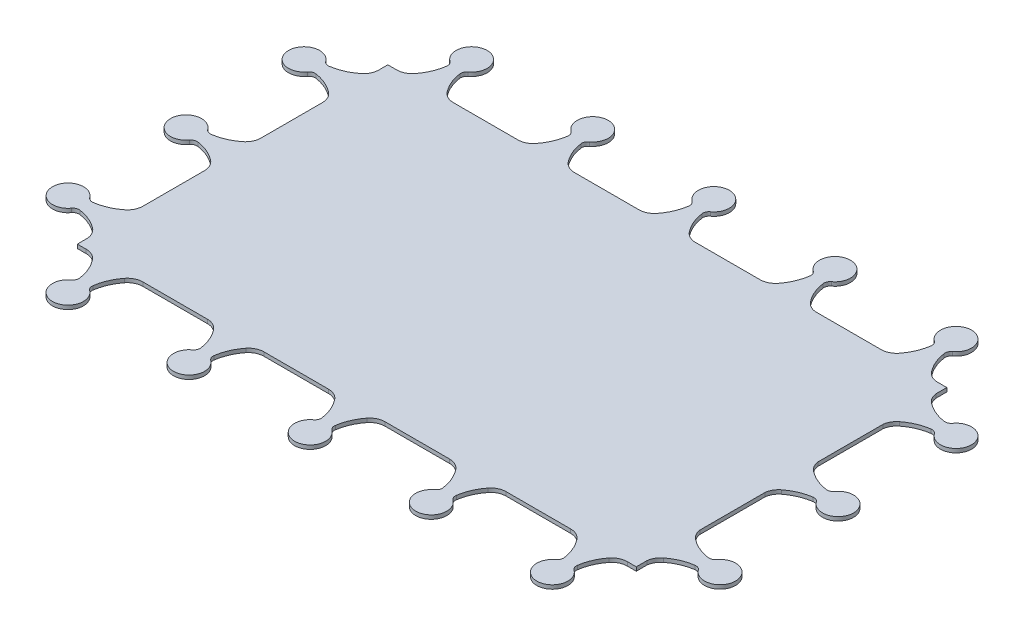
from build123d import *

# Parameters (mm, degrees)
BOSS_EXTRUDE1_DEPTH  = 3.175
BOSS_EXTRUDE2_DEPTH  = 3.175
LPATTERN1_COUNT      = 5
LPATTERN1_PITCH      = 99.06
MIRROR1_COPY_1_DEPTH = 3.175
MIRROR1_COPY_2_DEPTH = 3.175
MIRROR1_COPY_3_DEPTH = 3.175
MIRROR1_COPY_4_DEPTH = 3.175
MIRROR1_COPY_5_DEPTH = 3.175
BOSS_EXTRUDE3_DEPTH  = 3.175
LPATTERN2_COUNT      = 3
LPATTERN2_PITCH      = 96.52
MIRROR2_COPY_1_DEPTH = 3.175
MIRROR2_COPY_2_DEPTH = 3.175
MIRROR2_COPY_3_DEPTH = 3.175


with BuildPart() as part:
    # Sketch1 → Boss-Extrude1 (new body)
    with BuildSketch(Plane(origin=(0, 0, 0), x_dir=(1, 0, 0), z_dir=(0, 1, 0))):
        Polygon((0, 200.406867622), (0, 0), (457.2, 0), (457.2, 254), (53.593132378, 254), (7.268244995, 254), (0, 254), (0, 246.731755005), align=None)
    extrude(amount=BOSS_EXTRUDE1_DEPTH)

    # Sketch1<3> → Boss-Extrude2 (add)
    with BuildSketch(Plane(origin=(0, 0, 0), x_dir=(1, 0, 0), z_dir=(0, 1, 0))):
        with BuildLine():
            Line((7.268244995, 254), (53.593132378, 254))
            ThreePointArc((53.593132378, 254), (48.043028868, 255.276937756), (43.609009881, 258.850968343))
            ThreePointArc((43.609009881, 258.850968343), (38.533476821, 267.409528266), (35.84709227, 276.990411412))
            ThreePointArc((35.84709227, 276.990411412), (36.197138958, 279.690776765), (37.891385065, 281.82245119))
            ThreePointArc((37.891385065, 281.82245119), (30.430688687, 304.8), (22.969992308, 281.82245119))
            ThreePointArc((22.969992308, 281.82245119), (24.664238415, 279.690776765), (25.014285104, 276.990411412))
            ThreePointArc((25.014285104, 276.990411412), (22.327900553, 267.409528266), (17.252367493, 258.850968343))
            ThreePointArc((17.252367493, 258.850968343), (12.818348506, 255.276937756), (7.268244995, 254))
        make_face()
    boss_extrude2 = extrude(amount=BOSS_EXTRUDE2_DEPTH)

    # LPattern1: Boss-Extrude2 ×5
    with Locations(*[(i * LPATTERN1_PITCH, 0, 0) for i in range(1, LPATTERN1_COUNT)]):
        add(boss_extrude2)

    # Mirror1 copy 1 sketch → Mirror1 copy 1 (add)
    with BuildSketch(Plane(origin=(99.06, 0, -254), x_dir=(1, 0, 0), z_dir=(0, 1, 0))):
        with BuildLine():
            Line((7.268244995, -254), (53.593132378, -254))
            ThreePointArc((53.593132378, -254), (48.043028868, -255.276937756), (43.609009881, -258.850968343))
            ThreePointArc((43.609009881, -258.850968343), (38.533476821, -267.409528266), (35.84709227, -276.990411412))
            ThreePointArc((35.84709227, -276.990411412), (36.197138958, -279.690776765), (37.891385065, -281.82245119))
            ThreePointArc((37.891385065, -281.82245119), (30.430688687, -304.8), (22.969992308, -281.82245119))
            ThreePointArc((22.969992308, -281.82245119), (24.664238415, -279.690776765), (25.014285104, -276.990411412))
            ThreePointArc((25.014285104, -276.990411412), (22.327900553, -267.409528266), (17.252367493, -258.850968343))
            ThreePointArc((17.252367493, -258.850968343), (12.818348506, -255.276937756), (7.268244995, -254))
        make_face()
    extrude(amount=MIRROR1_COPY_1_DEPTH)

    # Mirror1 copy 2 sketch → Mirror1 copy 2 (add)
    with BuildSketch(Plane(origin=(198.12, 0, -254), x_dir=(1, 0, 0), z_dir=(0, 1, 0))):
        with BuildLine():
            Line((7.268244995, -254), (53.593132378, -254))
            ThreePointArc((53.593132378, -254), (48.043028868, -255.276937756), (43.609009881, -258.850968343))
            ThreePointArc((43.609009881, -258.850968343), (38.533476821, -267.409528266), (35.84709227, -276.990411412))
            ThreePointArc((35.84709227, -276.990411412), (36.197138958, -279.690776765), (37.891385065, -281.82245119))
            ThreePointArc((37.891385065, -281.82245119), (30.430688687, -304.8), (22.969992308, -281.82245119))
            ThreePointArc((22.969992308, -281.82245119), (24.664238415, -279.690776765), (25.014285104, -276.990411412))
            ThreePointArc((25.014285104, -276.990411412), (22.327900553, -267.409528266), (17.252367493, -258.850968343))
            ThreePointArc((17.252367493, -258.850968343), (12.818348506, -255.276937756), (7.268244995, -254))
        make_face()
    extrude(amount=MIRROR1_COPY_2_DEPTH)

    # Mirror1 copy 3 sketch → Mirror1 copy 3 (add)
    with BuildSketch(Plane(origin=(297.18, 0, -254), x_dir=(1, 0, 0), z_dir=(0, 1, 0))):
        with BuildLine():
            Line((7.268244995, -254), (53.593132378, -254))
            ThreePointArc((53.593132378, -254), (48.043028868, -255.276937756), (43.609009881, -258.850968343))
            ThreePointArc((43.609009881, -258.850968343), (38.533476821, -267.409528266), (35.84709227, -276.990411412))
            ThreePointArc((35.84709227, -276.990411412), (36.197138958, -279.690776765), (37.891385065, -281.82245119))
            ThreePointArc((37.891385065, -281.82245119), (30.430688687, -304.8), (22.969992308, -281.82245119))
            ThreePointArc((22.969992308, -281.82245119), (24.664238415, -279.690776765), (25.014285104, -276.990411412))
            ThreePointArc((25.014285104, -276.990411412), (22.327900553, -267.409528266), (17.252367493, -258.850968343))
            ThreePointArc((17.252367493, -258.850968343), (12.818348506, -255.276937756), (7.268244995, -254))
        make_face()
    extrude(amount=MIRROR1_COPY_3_DEPTH)

    # Mirror1 copy 4 sketch → Mirror1 copy 4 (add)
    with BuildSketch(Plane(origin=(396.24, 0, -254), x_dir=(1, 0, 0), z_dir=(0, 1, 0))):
        with BuildLine():
            Line((7.268244995, -254), (53.593132378, -254))
            ThreePointArc((53.593132378, -254), (48.043028868, -255.276937756), (43.609009881, -258.850968343))
            ThreePointArc((43.609009881, -258.850968343), (38.533476821, -267.409528266), (35.84709227, -276.990411412))
            ThreePointArc((35.84709227, -276.990411412), (36.197138958, -279.690776765), (37.891385065, -281.82245119))
            ThreePointArc((37.891385065, -281.82245119), (30.430688687, -304.8), (22.969992308, -281.82245119))
            ThreePointArc((22.969992308, -281.82245119), (24.664238415, -279.690776765), (25.014285104, -276.990411412))
            ThreePointArc((25.014285104, -276.990411412), (22.327900553, -267.409528266), (17.252367493, -258.850968343))
            ThreePointArc((17.252367493, -258.850968343), (12.818348506, -255.276937756), (7.268244995, -254))
        make_face()
    extrude(amount=MIRROR1_COPY_4_DEPTH)

    # Mirror1 copy 5 sketch → Mirror1 copy 5 (add)
    with BuildSketch(Plane(origin=(0, 0, -254), x_dir=(1, 0, 0), z_dir=(0, 1, 0))):
        with BuildLine():
            Line((7.268244995, -254), (53.593132378, -254))
            ThreePointArc((53.593132378, -254), (48.043028868, -255.276937756), (43.609009881, -258.850968343))
            ThreePointArc((43.609009881, -258.850968343), (38.533476821, -267.409528266), (35.84709227, -276.990411412))
            ThreePointArc((35.84709227, -276.990411412), (36.197138958, -279.690776765), (37.891385065, -281.82245119))
            ThreePointArc((37.891385065, -281.82245119), (30.430688687, -304.8), (22.969992308, -281.82245119))
            ThreePointArc((22.969992308, -281.82245119), (24.664238415, -279.690776765), (25.014285104, -276.990411412))
            ThreePointArc((25.014285104, -276.990411412), (22.327900553, -267.409528266), (17.252367493, -258.850968343))
            ThreePointArc((17.252367493, -258.850968343), (12.818348506, -255.276937756), (7.268244995, -254))
        make_face()
    extrude(amount=MIRROR1_COPY_5_DEPTH)

    # Sketch1<4> → Boss-Extrude3 (add)
    with BuildSketch(Plane(origin=(0, 0, 0), x_dir=(1, 0, 0), z_dir=(0, 1, 0))):
        with BuildLine():
            ThreePointArc((-4.850968343, 210.390990119), (-1.276937756, 205.956971132), (0, 200.406867622))
            Line((0, 200.406867622), (0, 246.731755005))
            ThreePointArc((0, 246.731755005), (-1.276937756, 241.181651494), (-4.850968343, 236.747632507))
            ThreePointArc((-4.850968343, 236.747632507), (-13.409528266, 231.672099447), (-22.990411412, 228.985714896))
            ThreePointArc((-22.990411412, 228.985714896), (-25.690776765, 229.335761585), (-27.82245119, 231.030007692))
            ThreePointArc((-27.82245119, 231.030007692), (-50.8, 223.569311313), (-27.82245119, 216.108614935))
            ThreePointArc((-27.82245119, 216.108614935), (-25.690776765, 217.802861042), (-22.990411412, 218.15290773))
            ThreePointArc((-22.990411412, 218.15290773), (-13.409528266, 215.466523179), (-4.850968343, 210.390990119))
        make_face()
    boss_extrude3 = extrude(amount=BOSS_EXTRUDE3_DEPTH)

    # LPattern2: Boss-Extrude3 ×3
    with Locations(*[(0, 0, i * LPATTERN2_PITCH) for i in range(1, LPATTERN2_COUNT)]):
        add(boss_extrude3)

    # Mirror2 copy 1 sketch → Mirror2 copy 1 (add)
    with BuildSketch(Plane(origin=(457.101377374, 0, 96.52), x_dir=(-1, 0, 0), z_dir=(0, 1, 0))):
        with BuildLine():
            ThreePointArc((-4.850968343, -210.390990119), (-1.276937756, -205.956971132), (0, -200.406867622))
            Line((0, -200.406867622), (0, -246.731755005))
            ThreePointArc((0, -246.731755005), (-1.276937756, -241.181651494), (-4.850968343, -236.747632507))
            ThreePointArc((-4.850968343, -236.747632507), (-13.409528266, -231.672099447), (-22.990411412, -228.985714896))
            ThreePointArc((-22.990411412, -228.985714896), (-25.690776765, -229.335761585), (-27.82245119, -231.030007692))
            ThreePointArc((-27.82245119, -231.030007692), (-50.8, -223.569311313), (-27.82245119, -216.108614935))
            ThreePointArc((-27.82245119, -216.108614935), (-25.690776765, -217.802861042), (-22.990411412, -218.15290773))
            ThreePointArc((-22.990411412, -218.15290773), (-13.409528266, -215.466523179), (-4.850968343, -210.390990119))
        make_face()
    extrude(amount=MIRROR2_COPY_1_DEPTH)

    # Mirror2 copy 2 sketch → Mirror2 copy 2 (add)
    with BuildSketch(Plane(origin=(457.101377374, 0, 193.04), x_dir=(-1, 0, 0), z_dir=(0, 1, 0))):
        with BuildLine():
            ThreePointArc((-4.850968343, -210.390990119), (-1.276937756, -205.956971132), (0, -200.406867622))
            Line((0, -200.406867622), (0, -246.731755005))
            ThreePointArc((0, -246.731755005), (-1.276937756, -241.181651494), (-4.850968343, -236.747632507))
            ThreePointArc((-4.850968343, -236.747632507), (-13.409528266, -231.672099447), (-22.990411412, -228.985714896))
            ThreePointArc((-22.990411412, -228.985714896), (-25.690776765, -229.335761585), (-27.82245119, -231.030007692))
            ThreePointArc((-27.82245119, -231.030007692), (-50.8, -223.569311313), (-27.82245119, -216.108614935))
            ThreePointArc((-27.82245119, -216.108614935), (-25.690776765, -217.802861042), (-22.990411412, -218.15290773))
            ThreePointArc((-22.990411412, -218.15290773), (-13.409528266, -215.466523179), (-4.850968343, -210.390990119))
        make_face()
    extrude(amount=MIRROR2_COPY_2_DEPTH)

    # Mirror2 copy 3 sketch → Mirror2 copy 3 (add)
    with BuildSketch(Plane(origin=(457.101377374, 0, 0), x_dir=(-1, 0, 0), z_dir=(0, 1, 0))):
        with BuildLine():
            ThreePointArc((-4.850968343, -210.390990119), (-1.276937756, -205.956971132), (0, -200.406867622))
            Line((0, -200.406867622), (0, -246.731755005))
            ThreePointArc((0, -246.731755005), (-1.276937756, -241.181651494), (-4.850968343, -236.747632507))
            ThreePointArc((-4.850968343, -236.747632507), (-13.409528266, -231.672099447), (-22.990411412, -228.985714896))
            ThreePointArc((-22.990411412, -228.985714896), (-25.690776765, -229.335761585), (-27.82245119, -231.030007692))
            ThreePointArc((-27.82245119, -231.030007692), (-50.8, -223.569311313), (-27.82245119, -216.108614935))
            ThreePointArc((-27.82245119, -216.108614935), (-25.690776765, -217.802861042), (-22.990411412, -218.15290773))
            ThreePointArc((-22.990411412, -218.15290773), (-13.409528266, -215.466523179), (-4.850968343, -210.390990119))
        make_face()
    extrude(amount=MIRROR2_COPY_3_DEPTH)


solid = part.part
